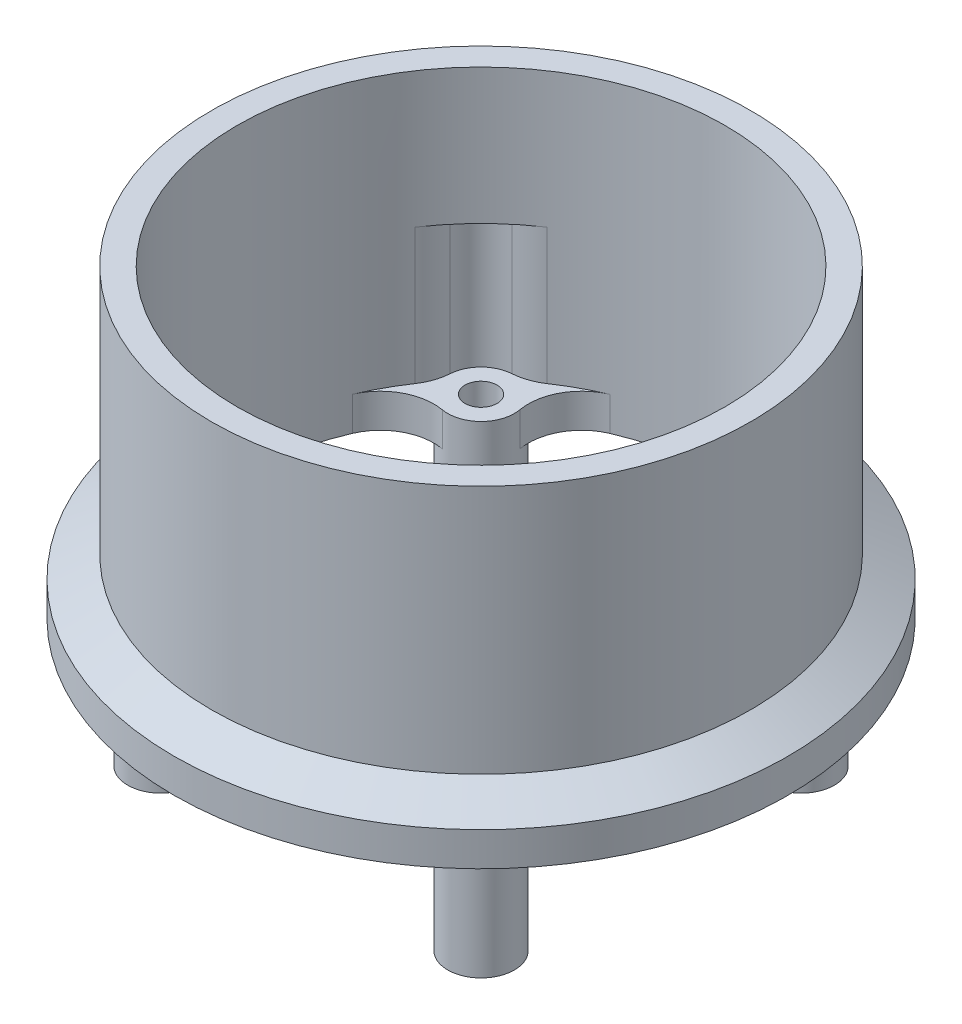
from build123d import *
from build123d.topology import SkipClean

# Parameters (mm, degrees)
SKETCH1_R               = 25.273
SKETCH1_R_2             = 22.86
BOSS_EXTRUDE1_DEPTH     = 25.4
SKETCH6_R               = 3.1250000000000004
SKETCH6_R_2             = 3.125000000000001
SKETCH6_R_3             = 3.125000000000005
BOSS_EXTRUDE2_DEPTH     = 3.175
SKETCH5_R               = 3.1250000000000004
SKETCH5_R_2             = 3.125000000000004
SKETCH5_R_3             = 3.125000000000001
CUT_EXTRUDE1_DEPTH      = 12.7
SKETCH10_R              = 25.273
BOSS_EXTRUDE3_DEPTH     = 3.175
CUT_EXTRUDE2_DEPTH      = 44.84756615822593
CUT_EXTRUDE2_DEPTH_BACK = 44.84756615822593
SKETCH3_R               = 1.2500000000000007
FILLET1_R               = 5
FILLET3_R               = 5
SKETCH11_R              = 1.2500000000000013
BOSS_EXTRUDE4_DEPTH     = 12
SKETCH13_R              = 1.5000000000000009
SKETCH13_R_2            = 1.5000000000000002
CUT_EXTRUDE3_DEPTH      = 55.07198619539511
SKETCH14_W              = 3.5
SKETCH14_H              = 3.174999999999997
CHAMFER1_SIZE           = 2.020725942
CHAMFER1_SIZE_2         = 3.5


with BuildPart() as part:
    # Sketch1 → Boss-Extrude1 (new body)
    with BuildSketch(Plane(origin=(0, 0, 0), x_dir=(1, 0, 0), z_dir=(0, 1, 0))):
        with Locations(Location((0, 0, 0), (0, 0, 270))):
            Circle(SKETCH1_R)
        with Locations(Location((0, 0, 0), (0, 0, 270))):
            Circle(SKETCH1_R_2, mode=Mode.SUBTRACT)
    extrude(amount=BOSS_EXTRUDE1_DEPTH)

    # Sketch6 → Boss-Extrude2 (add)
    with BuildSketch(Plane.XZ):
        with Locations(Location((-15.000000000000004, 15, 0), (0, 0, 73.279468642))):
            Circle(SKETCH6_R)
        with Locations(Location((-14.999999999999996, -15.000000000000007, 0), (0, 0, 163.279468642))):
            Circle(SKETCH6_R_2)
        with Locations(Location((15.00000000000001, -14.999999999999993, 0), (0, 0, 16.720531358))):
            Circle(SKETCH6_R)
        with Locations(Location((15.000000000000004, 15, 0), (0, 0, 106.720531358))):
            Circle(SKETCH6_R_3)
    extrude(amount=BOSS_EXTRUDE2_DEPTH)

    # Sketch5 → Cut-Extrude1 (cut)
    with BuildSketch(Plane(origin=(0, 12.7, 0), x_dir=(1, 0, 0), z_dir=(0, 1, 0))):
        with Locations(Location((-14.999999999999996, 15.000000000000007, 0), (0, 0, 90))):
            Circle(SKETCH5_R)
        with Locations(Location((15.00000000000001, 14.999999999999993, 0), (0, 0, 90))):
            Circle(SKETCH5_R)
        with Locations(Location((15.000000000000004, -15, 0), (0, 0, 90))):
            Circle(SKETCH5_R_2)
        with Locations(Location((-15.000000000000004, -15, 0), (0, 0, 90))):
            Circle(SKETCH5_R_3)
    extrude(amount=-CUT_EXTRUDE1_DEPTH, mode=Mode.SUBTRACT)


with BuildPart() as cut_extrude1_piece_1:
    # of the separate pieces the step leaves, piece 1, a body of its own (cut_extrude1_pieces)
    add(part.part.solids().sort_by_distance((0, 0, 25.273))[0])



with BuildPart() as cut_extrude1_piece_2:
    # of the separate pieces the step leaves, piece 2, a body of its own (cut_extrude1_pieces)
    add(part.part.solids().sort_by_distance((14.100925852, -3.175, 17.992873315))[0])


with BuildPart() as cut_extrude1_piece_3:
    # of the separate pieces the step leaves, piece 3, a body of its own (cut_extrude1_pieces)
    add(part.part.solids().sort_by_distance((17.992873315, -3.175, -14.100925852))[0])


with BuildPart() as cut_extrude1_piece_4:
    # of the separate pieces the step leaves, piece 4, a body of its own (cut_extrude1_pieces)
    add(part.part.solids().sort_by_distance((-17.992873315, -3.175, -14.100925852))[0])


with BuildPart() as cut_extrude1_piece_5:
    # of the separate pieces the step leaves, piece 5, a body of its own (cut_extrude1_pieces)
    add(part.part.solids().sort_by_distance((-14.100925852, -3.175, 17.992873315))[0])


with BuildPart() as cut_extrude1_piece_1_1:
    with SkipClean():  # the faces are left unmerged after this step: merging them gives an invalid solid
        add(cut_extrude1_piece_1.part)

        add(cut_extrude1_piece_2.part)  # Boss-Extrude3 merges Cut-Extrude1 piece 2

        add(cut_extrude1_piece_3.part)  # Boss-Extrude3 merges Cut-Extrude1 piece 3

        add(cut_extrude1_piece_4.part)  # Boss-Extrude3 merges Cut-Extrude1 piece 4

        add(cut_extrude1_piece_5.part)  # Boss-Extrude3 merges Cut-Extrude1 piece 5
        # Sketch10 → Boss-Extrude3 (add)
        with BuildSketch(Plane.XZ):
            with Locations(Location((0, 0, 0), (0, 0, 270))):
                Circle(SKETCH10_R)
            with BuildLine():
                ThreePointArc((-17.992873314506625, 14.100925852160042), (-22.86, -7.35e-15), (-17.992873314506618, -14.100925852160044))
                ThreePointArc((-17.992873314506618, -14.100925852160044), (-17.209708691207958, -17.209708691207968), (-14.100925852160033, -17.992873314506628))
                ThreePointArc((-14.100925852160033, -17.992873314506628), (1.155e-14, -22.86), (14.10092585216005, -17.992873314506614))
                ThreePointArc((14.10092585216005, -17.992873314506614), (17.20970869120797, -17.209708691207954), (17.99287331450663, -14.10092585216003))
                ThreePointArc((17.99287331450663, -14.10092585216003), (22.86, 2.54e-15), (17.992873314506628, 14.100925852160033))
                ThreePointArc((17.992873314506628, 14.100925852160033), (17.209708691207968, 17.209708691207965), (14.100925852160037, 17.99287331450662))
                ThreePointArc((14.100925852160037, 17.99287331450662), (-8.75e-15, 22.859999999999996), (-14.10092585216005, 17.992873314506618))
                ThreePointArc((-14.10092585216005, 17.992873314506618), (-17.20970869120796, 17.209708691207958), (-17.992873314506625, 14.100925852160042))
            make_face(mode=Mode.SUBTRACT)
        extrude(amount=BOSS_EXTRUDE3_DEPTH)

    # Sketch3 → Cut-Extrude2 (cut, two sides: drawn at the far end of the back side and taken through both)
    with BuildSketch(Plane(origin=(0, 0, 0), x_dir=(-1, 0, 0), z_dir=(0, -1, 0)).offset(-CUT_EXTRUDE2_DEPTH_BACK)):
        with Locations(Location((-15.00000000000001, 14.999999999999993, 0), (0, 0, 90))):
            Circle(SKETCH3_R)
        with Locations(Location((14.999999999999996, 15.000000000000007, 0), (0, 0, 90))):
            Circle(SKETCH3_R)
        with Locations(Location((15.000000000000004, -15, 0), (0, 0, 90))):
            Circle(SKETCH3_R)
        with Locations(Location((-15.000000000000004, -15, 0), (0, 0, 90))):
            Circle(SKETCH3_R)
    extrude(amount=CUT_EXTRUDE2_DEPTH + CUT_EXTRUDE2_DEPTH_BACK, mode=Mode.SUBTRACT)

    # Fillet1
    # the kernel refuses this fillet: 5 mm, written as the material it adds along each edge
    with BuildSketch(Plane(origin=(14.10092585215273, 0, 17.99287331450443), x_dir=(-0.8608874223501668, 0, 0.5087954854745522), z_dir=(0, -1, 0))) as fillet1_piece_1:
        with BuildLine():
            CenterArc((5.3164306254297475, 4.957201606076887), FILLET1_R, 200.44493479768204, 77.05705788713391)
            ThreePointArc((0.631388974913585, 3.210666541175879), (0.7695099639794132, 1.5160888458409856), (0, 0))
            ThreePointArc((0, 0), (2.984616996499313, -0.19567425701646401), (5.969233992998208, 6e-17))
        make_face()
    extrude(amount=3.175)
    with BuildSketch(Plane(origin=(17.992873314504436, 0, -14.10092585215272), x_dir=(0.5087954854745508, 0, 0.8608874223501678), z_dir=(0, -1, 0))) as fillet1_piece_2:
        with BuildLine():
            CenterArc((5.316430625429749, 4.9572016060768895), FILLET1_R, 200.44493479768207, 77.05705788713385)
            ThreePointArc((0.6313889749135845, 3.2106665411758786), (0.7695099639794142, 1.5160888458409876), (0, 0))
            ThreePointArc((0, 0), (2.984616996499308, -0.19567425701646796), (5.9692339929982055, -1e-16))
        make_face()
    extrude(amount=3.175)
    with BuildSketch(Plane(origin=(-14.100925852160035, 0, -17.992873314506628), x_dir=(0.665348701330496, 0, 0.7465327224159852), z_dir=(0, -1, 0))) as fillet1_piece_3:
        with BuildLine():
            CenterArc((5.889888167974704, -4.259988230871161), FILLET1_R, 121.57038627249773, 77.05705788713396)
            ThreePointArc((1.1518105546258381, -5.857054456762352), (0.3839083174921323, -2.9662841122227417), (0, 0))
            ThreePointArc((0, 0), (1.6360800466596406, -0.46250735570552437), (3.2721600933192807, 3e-17))
        make_face()
    extrude(amount=3.175)
    with BuildSketch(Plane(origin=(-17.992873314506625, 0, 14.100925852160042), x_dir=(0.7465327224159842, 0, -0.6653487013304972), z_dir=(0, -1, 0))) as fillet1_piece_4:
        with BuildLine():
            CenterArc((5.889888167974704, -4.259988230871161), FILLET1_R, 121.57038627249773, 77.05705788713396)
            ThreePointArc((1.1518105546258386, -5.857054456762347), (0.38390831749212756, -2.96628411222273), (0, 0))
            ThreePointArc((0, 0), (1.6360800466596437, -0.4625073557055245), (3.2721600933192807, 8e-17))
        make_face()
    extrude(amount=3.175)
    with BuildSketch(Plane(origin=(17.99287331450663, 0, 14.100925852160035), x_dir=(-0.7465327224159862, 0, -0.665348701330495), z_dir=(0, -1, 0))) as fillet1_piece_5:
        with BuildLine():
            CenterArc((5.889888167974704, 4.2599882308711665), FILLET1_R, 161.3725558403684, 77.05705788713396)
            ThreePointArc((1.1518105546258386, 5.857054456762349), (0.38390831749213894, 2.9662841122227275), (0, 0))
            ThreePointArc((0, 0), (1.6360800466596428, 0.46250735570552437), (3.272160093319286, 6e-17))
        make_face()
    extrude(amount=3.175)
    with BuildSketch(Plane(origin=(-17.992873314504422, 0, -14.100925852152734), x_dir=(-0.5087954854745543, 0, 0.8608874223501657), z_dir=(0, -1, 0))) as fillet1_piece_6:
        with BuildLine():
            CenterArc((5.316430625429729, -4.957201606076887), FILLET1_R, 82.49800731518394, 77.05705788713391)
            ThreePointArc((0.631388974913567, -3.2106665411758706), (0.769509963979407, -1.5160888458409818), (0, 0))
            ThreePointArc((0, 0), (2.984616996499318, 0.19567425701647095), (5.969233992998199, -2.4e-16))
        make_face()
    extrude(amount=3.175)
    with BuildSketch(Plane(origin=(14.100925852160053, 0, -17.992873314506614), x_dir=(-0.860887422350645, 0, -0.5087954854737433), z_dir=(0, -1, 0))) as fillet1_piece_7:
        with BuildLine():
            CenterArc((5.31643062543959, -4.9572016060775015), FILLET1_R, 82.49800731523791, 77.05705788713382)
            ThreePointArc((0.631388974921786, -3.210666541180892), (0.7695099639852782, -1.5160888458421276), (0, 0))
            ThreePointArc((0, 0), (2.9846169965017046, 0.1956742570136652), (5.969233993003391, -1.1e-16))
        make_face()
    extrude(amount=3.175)
    with BuildSketch(Plane(origin=(-14.10092585215273, 0, 17.992873314504426), x_dir=(0.6653487013295846, 0, -0.7465327224167976), z_dir=(0, -1, 0))) as fillet1_piece_8:
        with BuildLine():
            CenterArc((5.889888167962995, 4.25998823087436), FILLET1_R, 161.3725558404384, 77.05705788713385)
            ThreePointArc((1.1518105546121764, 5.857054456759753), (0.38390831748250376, 2.9662841122217563), (0, 0))
            ThreePointArc((0, 0), (1.6360800466563894, 0.4625073557035249), (3.2721600933127744, -3e-17))
        make_face()
    extrude(amount=3.175)

    # Fillet3
    fillet3_edges = [cut_extrude1_piece_1_1.edges().sort_by_distance(p)[0] for p in [
        (17.99287331450661, 6.35, 14.100925852160058),
        (14.10092585216007, 6.35, -17.9928733145066),
        (-17.992873314506618, 6.349999999999999, -14.100925852160048),
        (14.100925852160062, 6.35, 17.992873314506607),
        (-14.100925852160064, 6.35, 17.992873314506603),
        (-14.100925852160053, 6.35, -17.992873314506614),
        (17.99287331450662, 6.35, -14.100925852160046),
        (-17.99287331450661, 6.35, 14.100925852160056),
    ]]
    fillet(fillet3_edges, radius=FILLET3_R)

    # Sketch11 → Boss-Extrude4 (add)
    # profile 1 of 4: a face of its own
    with SkipClean():  # the faces are left unmerged after this step: merging them gives an invalid solid
        with BuildSketch(Plane.XZ.offset(3.175)):
            with BuildLine():
                ThreePointArc((-15.550098731860036, 11.92379838352458), (-12.994187638020772, 12.60368162204366), (-11.875000000000004, 15))
                ThreePointArc((-11.875000000000004, 15), (-11.887223502121808, 15.276129451991556), (-11.923798383524584, 15.550098731860032))
                ThreePointArc((-11.923798383524584, 15.550098731860032), (-17.209708691207965, 17.20970869120796), (-15.550098731860036, 11.92379838352458))
            make_face()
            with Locations(Location((-15.000000000000004, 15, 0), (0, 0, 270))):
                Circle(SKETCH11_R, mode=Mode.SUBTRACT)
        # profile 2 of 4: a face of its own
        with BuildSketch(Plane.XZ.offset(3.175)):
            with BuildLine():
                ThreePointArc((15.550098731860036, 11.92379838352458), (17.39631837795634, 12.994187638020769), (18.125000000000004, 15))
                ThreePointArc((18.125000000000004, 15), (15.27612945199156, 18.112776497878194), (11.923798383524584, 15.550098731860034))
                ThreePointArc((11.923798383524579, 15.550098731860034), (12.790291308792039, 12.790291308792035), (15.550098731860038, 11.923798383524574))
            make_face()
            with Locations(Location((15.000000000000004, 15, 0), (0, 0, 270))):
                Circle(SKETCH11_R, mode=Mode.SUBTRACT)
        # profile 3 of 4: a face of its own
        with BuildSketch(Plane.XZ.offset(3.175)):
            with BuildLine():
                ThreePointArc((11.923798383524582, -15.550098731860029), (15.276129451991556, -18.112776497878198), (18.125000000000004, -15))
                ThreePointArc((18.125000000000004, -15), (17.396318377956344, -12.99418763802077), (15.55009873186004, -11.92379838352458))
                ThreePointArc((15.550098731860041, -11.923798383524572), (12.790291308792046, -12.790291308792032), (11.92379838352459, -15.550098731860029))
            make_face()
            with Locations(Location((15.000000000000004, -15, 0), (0, 0, 270))):
                Circle(SKETCH11_R, mode=Mode.SUBTRACT)
        # profile 4 of 4: a face of its own
        with BuildSketch(Plane.XZ.offset(3.175)):
            with BuildLine():
                ThreePointArc((-11.923798383524584, -15.55009873186004), (-11.887223502121808, -15.27612945199156), (-11.875000000000004, -15))
                ThreePointArc((-11.875000000000004, -15), (-12.99418763802077, -12.603681622043663), (-15.550098731860032, -11.923798383524579))
                ThreePointArc((-15.550098731860032, -11.923798383524579), (-17.209708691207968, -17.209708691207958), (-11.923798383524584, -15.55009873186004))
            make_face()
            with Locations(Location((-15.000000000000004, -15, 0), (0, 0, 270))):
                Circle(SKETCH11_R, mode=Mode.SUBTRACT)
        extrude(amount=BOSS_EXTRUDE4_DEPTH)

    # Sketch13 → Cut-Extrude3 (cut, through all)
    with SkipClean():  # the faces are left unmerged after this step: merging them gives an invalid solid
        with BuildSketch(Plane.XZ.offset(15.175)):
            with Locations(Location((-15.000000000000004, 15, 0), (0, 0, 270))):
                Circle(SKETCH13_R)
            with Locations(Location((15.000000000000004, 15, 0), (0, 0, 270))):
                Circle(SKETCH13_R_2)
            with Locations(Location((15.00000000000001, -14.999999999999993, 0), (0, 0, 270))):
                Circle(SKETCH13_R_2)
            with Locations(Location((-14.999999999999996, -15.000000000000007, 0), (0, 0, 270))):
                Circle(SKETCH13_R_2)
        extrude(amount=-CUT_EXTRUDE3_DEPTH, mode=Mode.SUBTRACT)

    # Sketch14 → Revolve1 (revolve)
    with SkipClean():  # the faces are left unmerged after this step: merging them gives an invalid solid
        with BuildSketch(Plane(origin=(0, 0, 0), x_dir=(0, 0, -1), z_dir=(1, 0, 0)), mode=Mode.PRIVATE) as revolve1_sk:
            with Locations((-27.023000000000003, -1.5874999999999986)):
                Rectangle(SKETCH14_W, SKETCH14_H)
        revolve(revolve1_sk.sketch.rotate(Axis((0, 25.4, 0), (0, -1, 0)), 156.91836179), axis=Axis((0, 25.4, 0), (0, -1, 0)))

    # Chamfer1
    # the kernel refuses this chamfer: 3.5, 2.020725942 mm, written as the material it adds along each edge
    with BuildSketch(Plane(origin=(0, 0, 0), x_dir=(-2.1e-16, 0, 1), z_dir=(1, 0, 2.1e-16))) as chamfer1_piece_1_section:
        Polygon((25.273, -CHAMFER1_SIZE), (25.273000000000007 + CHAMFER1_SIZE_2, 0), (25.273000000000007, 0), align=None)
    chamfer1_piece_1 = revolve(axis=Axis((0, 0, 0), (0, -1, 0)), revolution_arc=156.91836178999998, mode=Mode.PRIVATE)
    chamfer1_piece_1 = chamfer1_piece_1 & Plane(origin=(0, 0.988052825602503, 0), x_dir=(-0.39204231787014937, 0, -0.9199471838094841), z_dir=(0, -1, 0)) * Cylinder(28.773, 116, mode=Mode.PRIVATE)
    add(chamfer1_piece_1)
    with BuildSketch(Plane(origin=(0, 0, 0), x_dir=(-1.8e-16, 0, 1), z_dir=(-1, 0, -1.8e-16))) as chamfer1_piece_2_section:
        Polygon((25.273, CHAMFER1_SIZE), (25.273 + CHAMFER1_SIZE_2, 0), (25.273, 0), align=None)
    chamfer1_piece_2 = revolve(axis=Axis((0, 0, 0), (0, 1, 0)), revolution_arc=180, mode=Mode.PRIVATE)
    chamfer1_piece_2 = chamfer1_piece_2 & Plane(origin=(0, 0.9853703609509775, 0), x_dir=(-0.39204231787014937, 0, -0.9199471838094841), z_dir=(0, -1, 0)) * Cylinder(28.773, 116, mode=Mode.PRIVATE)
    add(chamfer1_piece_2)
    with BuildSketch(Plane(origin=(0, 0, 0), x_dir=(-0.39204231787014926, 0, -0.919947183809484), z_dir=(-0.919947183809484, 0, 0.39204231787014926))) as chamfer1_piece_3_section:
        Polygon((25.272999999999993, -CHAMFER1_SIZE), (25.273000000000003 + CHAMFER1_SIZE_2, 0), (25.273000000000003, 0), align=None)
    chamfer1_piece_3 = revolve(axis=Axis((0, 0, 0), (0, -1, 0)), revolution_arc=23.08163820999999, mode=Mode.PRIVATE)
    chamfer1_piece_3 = chamfer1_piece_3 & Plane(origin=(0, 0.6408535162382758, 0), x_dir=(-0.39204231787014937, 0, -0.9199471838094841), z_dir=(0, -1, 0)) * Cylinder(28.773, 116, mode=Mode.PRIVATE)
    add(chamfer1_piece_3)


solid = cut_extrude1_piece_1_1.part
